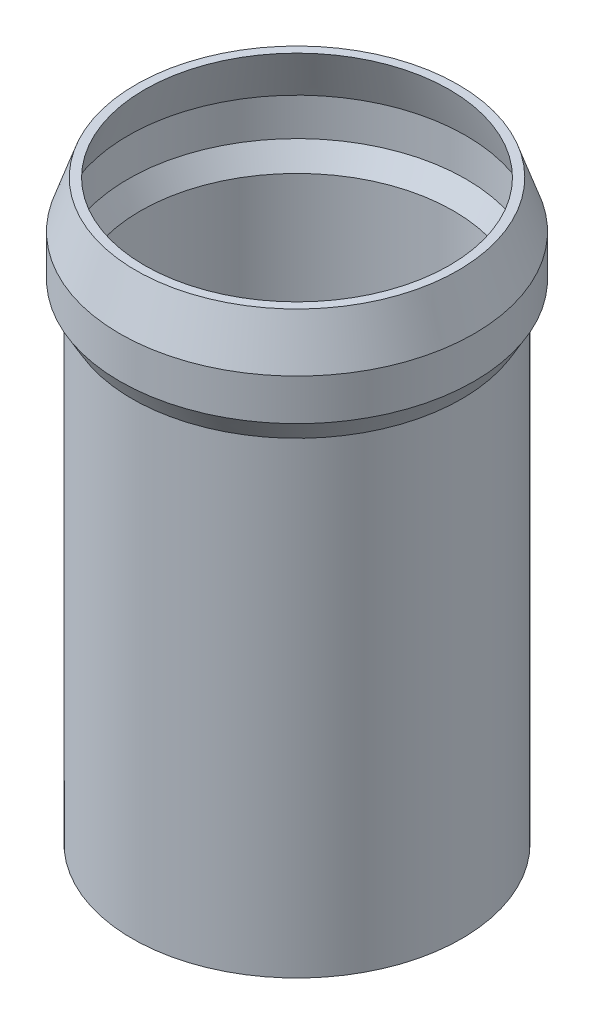
from build123d import *

# Parameters (mm, degrees)
FILLET1_SIZE = 1.5


# Read off the part's stored shape, not the designer's step: Shell1
with BuildPart() as part:
    # Sketch1 → Revolve1 (revolve)
    with BuildSketch(Plane.XY, mode=Mode.PRIVATE) as revolve1_sk:
        Polygon((20, 0), (20, 56.727116956), (21.5, 59.325193167), (21.5, 64.325193167), (19.547262907, 69.998535907), (0, 69.998535907), (0, 2.4), (4.5, 2.4), (4.5, 1.15), (19, 1.15), (19, 0), align=None)
    revolve(revolve1_sk.sketch.rotate(Axis((0, 2.4, 0), (0, 1, 0)), 90), axis=Axis((0, 2.4, 0), (0, 1, 0)))

    # Fillet1
    # the kernel refuses this chamfer: 1.5 mm, written as the material it takes off along each edge
    with BuildSketch(Plane(origin=(0, 1.15, 0), x_dir=(0, 0, -1), z_dir=(1, 0, 0))) as fillet1_piece_1_section:
        Polygon((4.5, FILLET1_SIZE), (4.5 + FILLET1_SIZE, 0), (4.5, 0), align=None)
    fillet1_piece_1 = revolve(axis=Axis((0, 1.15, 0), (0, 1, 0)), mode=Mode.PRIVATE)
    fillet1_piece_1 = split(fillet1_piece_1, bisect_by=Plane(origin=(0, 2.4, 5.37255081), z_dir=(0, -1, 0)), keep=Keep.TOP, mode=Mode.PRIVATE)
    add(fillet1_piece_1, mode=Mode.SUBTRACT)

    # Shell1 outline → Shell1 (revolve, cut)
    with BuildSketch(Plane.XY):
        Polygon((18.489685342, 69.998535907), (0, 69.998535907), (0, 3.4), (5.164213562, 3.4), (6.414213562, 2.15), (19, 2.15), (19, 56.995066148), (20.5, 59.59314236), (20.5, 64.157911426), align=None)
    revolve(axis=Axis((0, 0, 0), (0, 1, 0)), mode=Mode.SUBTRACT)


solid = part.part
